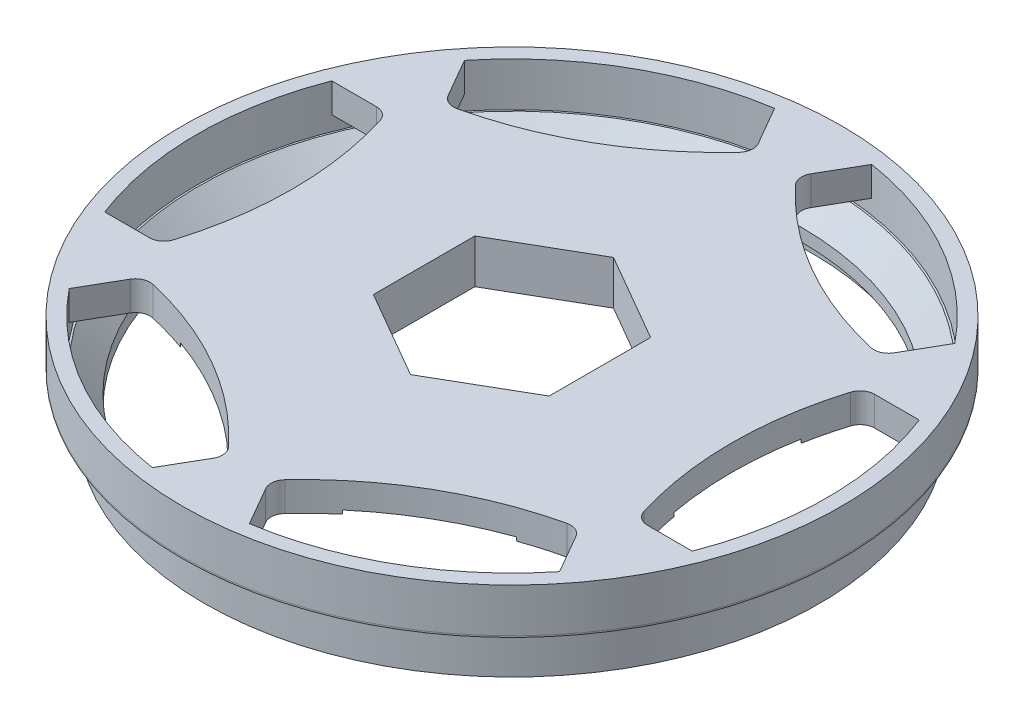
from build123d import *

# Parameters (mm, degrees)
SKIZZE1_R                            = 44
AUFSATZ_LINEAR_AUSTRAGEN1_DEPTH      = 4
SCHNITT_LINEAR_START                 = -10
SCHNITT_LINEAR_AUSTRAGEN2_DEPTH      = 10
SKIZZE4_R                            = 21.007106764
AUFSATZ_LINEAR_AUSTRAGEN4_DEPTH      = 6
KREISMUSTER1_COUNT                   = 6
SCHNITT_LINEAR_AUSTRAGEN3_DEPTH      = 4
SCHNITT_LINEAR_AUSTRAGEN3_DEPTH_BACK = 10
VERRUNDUNG1_R                        = 2
SKIZZE8_R                            = 45
SKIZZE8_R_2                          = 43
AUFSATZ_LINEAR_AUSTRAGEN2_DEPTH      = 6
SKIZZE9_R                            = 45
SKIZZE9_R_2                          = 39.5
AUFSATZ_LINEAR_AUSTRAGEN3_DEPTH      = 7
FASE1_SIZE                           = 3.25
SKIZZE7_R                            = 32
SKIZZE7_R_2                          = 21.5
SCHNITT_LINEAR_AUSTRAGEN7_DEPTH      = 0.5
SKIZZE10_R                           = 50
SKIZZE10_R_2                         = 42
SCHNITT_LINEAR_AUSTRAGEN9_DEPTH      = 6
SKIZZE11_R                           = 40.9
SKIZZE11_R_2                         = 30
SCHNITT_LINEAR_AUSTRAGEN10_DEPTH     = 2
FASE2_SIZE                           = 0.803847577
FASE2_SIZE_2                         = 3
FASE3_SIZE                           = 2


# Some blends are built 0.0001 mm under size
with BuildPart() as part:
    # Skizze1 → Aufsatz-Linear austragen1 (new body)
    with BuildSketch(Plane(origin=(0, 0, 0), x_dir=(1, 0, 0), z_dir=(0, 1, 0))):
        with Locations(Location((0, 0, 0), (0, 0, 270))):
            Circle(SKIZZE1_R)
    extrude(amount=AUFSATZ_LINEAR_AUSTRAGEN1_DEPTH)

    # Skizze2 → Schnitt-Linear austragen2 (cut)
    with BuildSketch(Plane(origin=(0, 4, 0), x_dir=(1, 0, 0), z_dir=(0, 1, 0)).offset(SCHNITT_LINEAR_START)):
        with BuildLine():
            ThreePointArc((-30, 0), (-30.647234858, 7.855929826), (-32.571484726, 15.5))
            Line((-32.571484726, 15.5), (-41.179485184, 15.5))
            ThreePointArc((-41.179485184, 15.5), (-44, 0), (-41.179485184, -15.5))
            Line((-41.179485184, -15.5), (-32.571484726, -15.5))
            ThreePointArc((-32.571484726, -15.5), (-30.647234858, -7.855929826), (-30, 0))
        make_face()
    schnitt_linear_austragen2 = extrude(amount=SCHNITT_LINEAR_AUSTRAGEN2_DEPTH, mode=Mode.SUBTRACT)

    # Skizze4 → Aufsatz-Linear austragen4 (add)
    with BuildSketch(Plane(origin=(0, 4, 0), x_dir=(1, 0, 0), z_dir=(0, 1, 0))):
        with Locations(Location((0, 0, 0), (0, 0, 270))):
            Circle(SKIZZE4_R)
    extrude(amount=-AUFSATZ_LINEAR_AUSTRAGEN4_DEPTH)

    # Kreismuster1: Schnitt-Linear austragen2 ×6 about axis
    kreismuster1_axis = Axis((0, 0, 0), (0, 1, 0))
    for i in range(1, KREISMUSTER1_COUNT):
        add(schnitt_linear_austragen2.rotate(kreismuster1_axis, i * 360 / KREISMUSTER1_COUNT), mode=Mode.SUBTRACT)

    # Skizze3 → Schnitt-Linear austragen3 (cut, two sides: drawn at the far end of the back side and taken through both)
    with BuildSketch(Plane.XZ.offset(-SCHNITT_LINEAR_AUSTRAGEN3_DEPTH_BACK)):
        Polygon((12, 6.92820323), (0, 13.856406461), (-12, 6.92820323), (-12, -6.92820323), (0, -13.856406461), (12, -6.92820323), align=None)
    extrude(amount=SCHNITT_LINEAR_AUSTRAGEN3_DEPTH + SCHNITT_LINEAR_AUSTRAGEN3_DEPTH_BACK, mode=Mode.SUBTRACT)

    # Verrundung1
    verrundung1_edges = [part.edges().sort_by_distance(p)[0] for p in [
        (-32.571484726, 2, 15.5),
        (-32.571484726, 2, -15.5),
        (-29.709136122, 2, -20.457733212),
        (-2.862348604, 2, -35.957733212),
        (2.862348604, 2, -35.957733212),
        (29.709136122, 2, -20.457733212),
        (32.571484726, 2, -15.5),
        (32.571484726, 2, 15.5),
        (29.709136122, 2, 20.457733212),
        (2.862348604, 2, 35.957733212),
        (-2.862348604, 2, 35.957733212),
        (-29.709136122, 2, 20.457733212),
    ]]
    fillet(verrundung1_edges, radius=VERRUNDUNG1_R)

    # Skizze8 → Aufsatz-Linear austragen2 (add)
    with BuildSketch(Plane(origin=(0, 4, 0), x_dir=(1, 0, 0), z_dir=(0, 1, 0))):
        with Locations(Location((0, 0, 0), (0, 0, 270))):
            Circle(SKIZZE8_R)
        with Locations(Location((0, 0, 0), (0, 0, 270))):
            Circle(SKIZZE8_R_2, mode=Mode.SUBTRACT)
    extrude(amount=-AUFSATZ_LINEAR_AUSTRAGEN2_DEPTH)

    # Skizze7 → Schnitt-Linear austragen7 (cut)
    with BuildSketch(Plane.XZ):
        Circle(SKIZZE7_R)
        with Locations(Location((0, 0, 0), (0, 0, 270))):
            Circle(SKIZZE7_R_2, mode=Mode.SUBTRACT)
    extrude(amount=-SCHNITT_LINEAR_AUSTRAGEN7_DEPTH, mode=Mode.SUBTRACT)

    # Fase3
    fase3_edges = [part.edges().sort_by_distance(p)[0] for p in [
        (0, -2, -21.007106764),
    ]]
    chamfer(fase3_edges, length=FASE3_SIZE - 0.0001)  # a hair under: the kernel refuses the full size


with BuildPart() as body_2:
    # Skizze9 → Aufsatz-Linear austragen3 (new body)
    with BuildSketch(Plane.XZ.offset(2)):
        with Locations(Location((0, 0, 0), (0, 0, 270))):
            Circle(SKIZZE9_R)
        with Locations(Location((0, 0, 0), (0, 0, 270))):
            Circle(SKIZZE9_R_2, mode=Mode.SUBTRACT)
    extrude(amount=AUFSATZ_LINEAR_AUSTRAGEN3_DEPTH)

    # Fase1
    fase1_edges = [body_2.edges().sort_by_distance(p)[0] for p in [
        (0, -2, 39.5),
    ]]
    chamfer(fase1_edges, length=FASE1_SIZE)

    # Skizze10 → Schnitt-Linear austragen9 (cut)
    with BuildSketch(Plane.XZ.offset(9)):
        Circle(SKIZZE10_R)
        with Locations(Location((0, 0, 0), (0, 0, 270))):
            Circle(SKIZZE10_R_2, mode=Mode.SUBTRACT)
    extrude(amount=-SCHNITT_LINEAR_AUSTRAGEN9_DEPTH, mode=Mode.SUBTRACT)

    # Skizze11 → Schnitt-Linear austragen10 (cut)
    with BuildSketch(Plane.XZ.offset(9)):
        with Locations(Location((0, 0, 0), (0, 0, 270))):
            Circle(SKIZZE11_R)
        with Locations((-1.948563864, 1.772578218)):
            Circle(SKIZZE11_R_2, mode=Mode.SUBTRACT)
    extrude(amount=-SCHNITT_LINEAR_AUSTRAGEN10_DEPTH, mode=Mode.SUBTRACT)

    # Fase2
    # the kernel refuses this chamfer: 3, 0.803847577 mm, written as the material it takes off along each edge
    with BuildSketch(Plane(origin=(0, -3, 0), x_dir=(0, 0, -1), z_dir=(1, 0, 0))) as fase2_piece_1_section:
        Polygon((45, FASE2_SIZE), (45 - FASE2_SIZE_2, 0), (45, 0), align=None)
    fase2_piece_1 = revolve(axis=Axis((0, -3, 0), (0, 1, 0)), mode=Mode.PRIVATE)
    fase2_piece_1 = fase2_piece_1 - Plane(origin=(0, -2.653988874, 0), x_dir=(0, 0, -1), z_dir=(0, -1, 0)) * Cylinder(42, 180, mode=Mode.PRIVATE)
    add(fase2_piece_1, mode=Mode.SUBTRACT)


solid = Compound([part.part, body_2.part])
